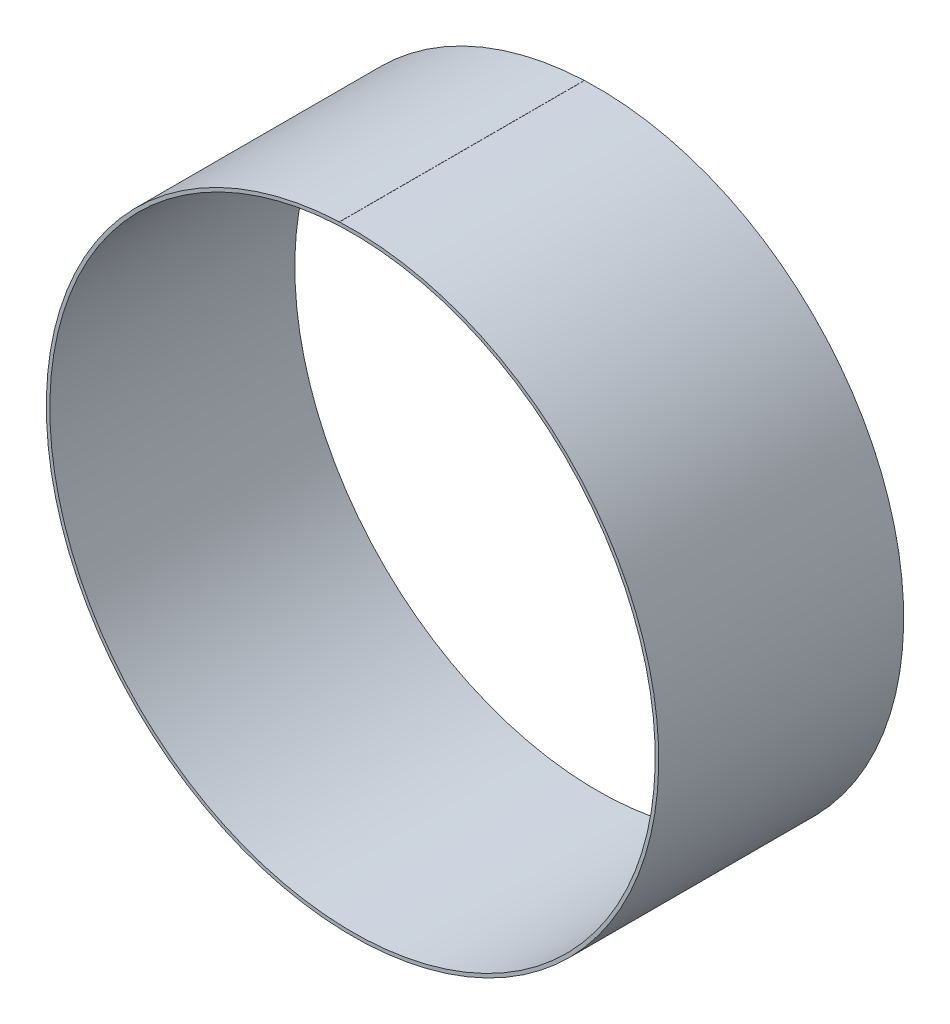
from build123d import *

# Parameters (mm, degrees)
BASE_FLANGE1_DEPTH      = 10
BASE_FLANGE1_DEPTH_BACK = 130


# Sheet-metal steps are written as plain solids
with BuildPart() as part:
    # Sketch1 → Base-Flange1 (new, two sides: drawn at the far end of the back side and taken through both)
    with BuildSketch(Plane.XY.offset(-BASE_FLANGE1_DEPTH_BACK)):
        with BuildLine():
            ThreePointArc((-7.453775566, 172.83935093), (7.403775876, -172.841499944), (-7.353775566, 172.843634493))
            Line((-7.353775566, 172.843634493), (-7.438790313, 174.8418268))
            ThreePointArc((-7.438790313, 174.8418268), (7.489368661, -174.839667573), (-7.539946382, 174.837493715))
            Line((-7.539946382, 174.837493715), (-7.453775566, 172.83935093))
        make_face()
    extrude(amount=BASE_FLANGE1_DEPTH + BASE_FLANGE1_DEPTH_BACK)


solid = part.part
